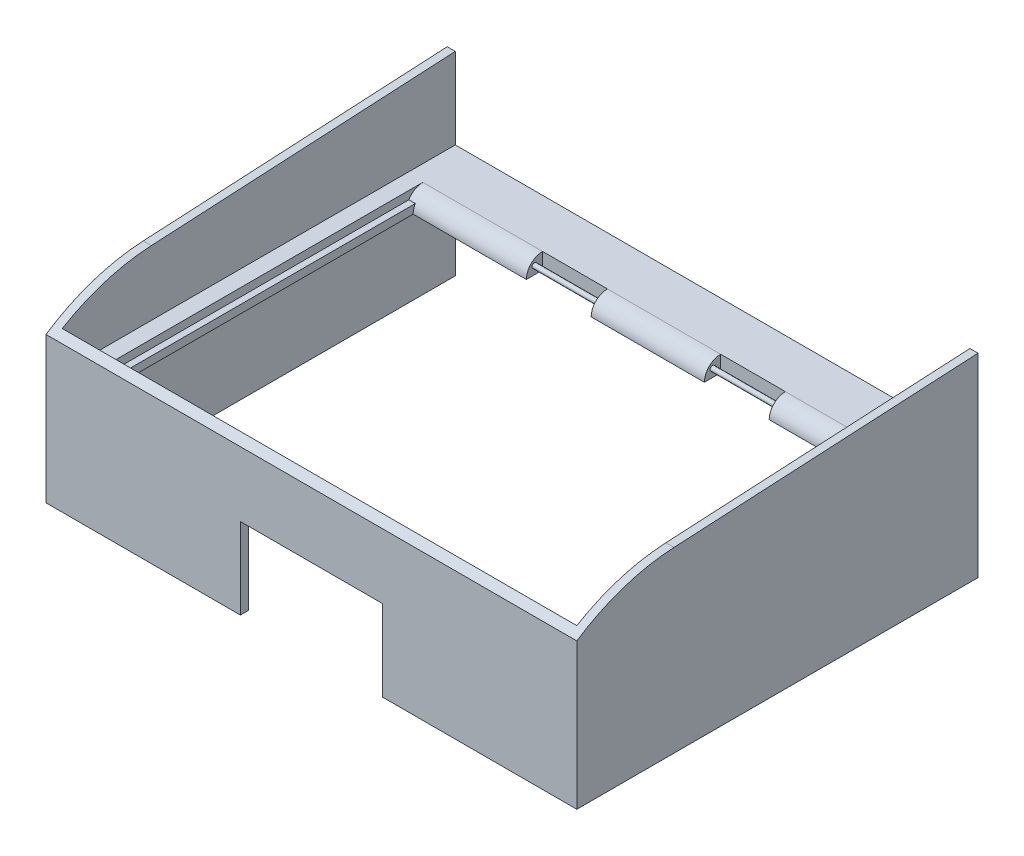
from build123d import *

# Parameters (mm, degrees)
SKETCH1_W               = 416.08
SKETCH1_H               = 314.48
BOSS_EXTRUDE2_DEPTH     = 152.4
SKETCH2_W               = 403.38
SKETCH2_H               = 308.13
CUT_EXTRUDE1_DEPTH      = 339.705913999
CUT_EXTRUDE2_DEPTH      = 476.456316699
CUT_EXTRUDE3_REACH      = 430.846
SKETCH4_W               = 111.28
SKETCH4_H               = 63.5
SKETCH5_W               = 403.38
SKETCH5_H               = 12.7
BOSS_EXTRUDE3_DEPTH     = 308.13
SKETCH6_W               = 377.98
SKETCH6_H               = 231.93
CUT_EXTRUDE4_DEPTH      = 6.35
CUT_EXTRUDE5_DEPTH      = 314.544954796
CUT_EXTRUDE5_DEPTH_BACK = 314.544954796
FILLET2_R               = 12.7
BOSS_EXTRUDE4_REACH     = 382.621
SKETCH8_R               = 1.905


with BuildPart() as part:
    # Sketch1 → Boss-Extrude2 (new body)
    with BuildSketch(Plane(origin=(0, 0, 0), x_dir=(1, 0, 0), z_dir=(0, 1, 0))):
        with Locations((40.527, 15.127)):
            Rectangle(SKETCH1_W, SKETCH1_H)
    extrude(amount=BOSS_EXTRUDE2_DEPTH)

    # Sketch2 → Cut-Extrude1 (cut, through all)
    with BuildSketch(Plane(origin=(0, 152.4, 0), x_dir=(1, 0, 0), z_dir=(0, 1, 0))):
        with Locations((40.527, 18.302)):
            Rectangle(SKETCH2_W, SKETCH2_H)
    extrude(amount=-CUT_EXTRUDE1_DEPTH, mode=Mode.SUBTRACT)

    # Sketch3 → Cut-Extrude2 (cut, through all)
    with BuildSketch(Plane(origin=(248.567, 0, 0), x_dir=(0, 0, -1), z_dir=(1, 0, 0))):
        with BuildLine():
            Line((-142.113, 114.3), (-142.113, 152.4))
            Line((-142.113, 152.4), (172.367, 152.4))
            Line((172.367, 152.4), (-65.913, 139.7))
            ThreePointArc((-65.913, 139.7), (-105.728307199, 132.145921598), (-142.113, 114.3))
        make_face()
    extrude(amount=-CUT_EXTRUDE2_DEPTH, mode=Mode.SUBTRACT)

    # Sketch4 → Cut-Extrude3 (cut, up to next)
    with BuildSketch(Plane.XY.offset(142.113), mode=Mode.PRIVATE) as cut_extrude3_sk1:
        with Locations((40.527, 31.75)):
            Rectangle(SKETCH4_W, SKETCH4_H)
    cut_extrude3_tool1 = extrude(cut_extrude3_sk1.sketch, amount=-CUT_EXTRUDE3_REACH, mode=Mode.PRIVATE) & part.part
    add(cut_extrude3_tool1.solids().sort_by_distance((40.527, 31.75, 142.113))[0], mode=Mode.SUBTRACT)

    # Sketch5 → Boss-Extrude3 (add)
    with BuildSketch(Plane(origin=(0, 0, 135.763), x_dir=(-1, 0, 0), z_dir=(0, 0, -1))):
        with Locations((-40.527, 82.55)):
            Rectangle(SKETCH5_W, SKETCH5_H)
    extrude(amount=BOSS_EXTRUDE3_DEPTH)

    # Sketch6 → Cut-Extrude4 (cut)
    with BuildSketch(Plane(origin=(0, 88.9, 0), x_dir=(1, 0, 0), z_dir=(0, 1, 0))):
        with Locations((40.527, 5.602)):
            Rectangle(SKETCH6_W, SKETCH6_H)
    extrude(amount=-CUT_EXTRUDE4_DEPTH, mode=Mode.SUBTRACT)

    # Sketch7 → Cut-Extrude5 (cut, two sides: drawn at the far end of the back side and taken through both)
    with BuildSketch(Plane(origin=(0, 82.55, 0), x_dir=(1, 0, 0), z_dir=(0, 1, 0)).offset(-CUT_EXTRUDE5_DEPTH_BACK)):
        Polygon((-54.643, 134.267), (-3.843, 134.267), (-3.843, 121.567), (84.897, 121.567), (84.897, 134.267), (135.697, 134.267), (135.697, 121.567), (224.437, 121.567), (224.437, -105.283), (-143.383, -105.283), (-143.383, 121.567), (-54.643, 121.567), align=None)
    extrude(amount=CUT_EXTRUDE5_DEPTH + CUT_EXTRUDE5_DEPTH_BACK, mode=Mode.SUBTRACT)

    # Fillet2
    fillet2_edges = [part.edges().sort_by_distance(p)[0] for p in [
        (182.607, 88.9, -121.567),
        (40.527, 88.9, -121.567),
        (-101.553, 88.9, -121.567),
    ]]
    fillet(fillet2_edges, radius=FILLET2_R - 0.0001)  # a hair under: the kernel refuses the full size

    # Boss-Extrude4: up to this face of the body (flat: up to its plane)
    boss_extrude4_end = Plane(part.part.faces().sort_by_distance((135.697, 81.590060551, -128.876939449))[0])
    # Sketch8 → Boss-Extrude4 (add, up to the picked face)
    with BuildSketch(Plane(origin=(-54.643, 0, 0), x_dir=(0, 0, -1), z_dir=(1, 0, 0)), mode=Mode.PRIVATE) as boss_extrude4_sk1:
        with Locations(Location((127.917, 82.55, 0), (0, 0, 180))):
            Circle(SKETCH8_R)
    boss_extrude4_tool1 = split(extrude(boss_extrude4_sk1.sketch, amount=BOSS_EXTRUDE4_REACH, mode=Mode.PRIVATE), bisect_by=boss_extrude4_end, keep=Keep.BOTH, mode=Mode.PRIVATE)
    add(boss_extrude4_tool1.solids().sort_by(Axis((-54.643, 82.55, -127.917), (1, 0, 0)))[0])


solid = part.part
